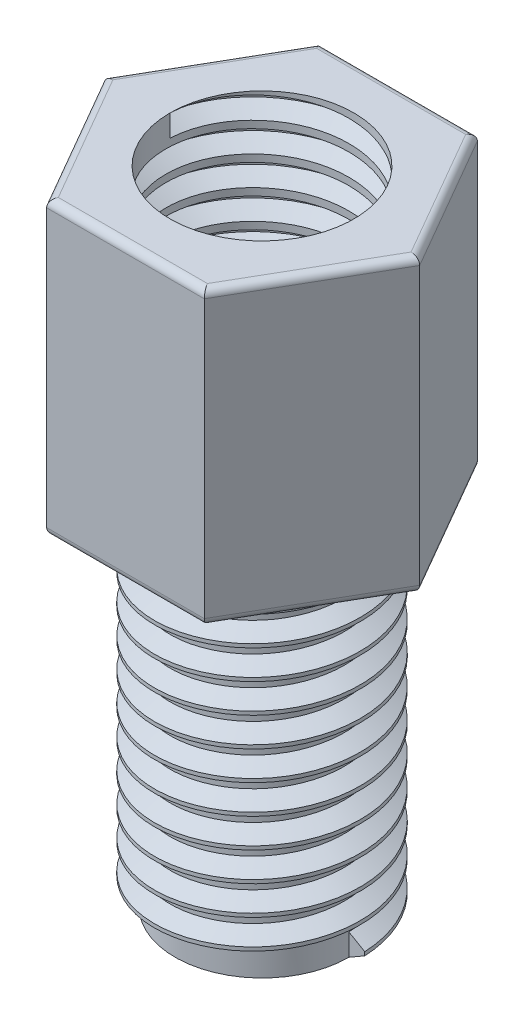
from build123d import *

# Parameters (mm, degrees)
BOSS_EXTRUDE1_DEPTH              = 5
BOSS_EXTRUDE2_START              = -5
SKETCH2_R                        = 1.49
BOSS_EXTRUDE2_DEPTH              = 6
TAP_DRILL_FOR_M3_HELICOIL1_D     = 3.15
TAP_DRILL_FOR_M3_HELICOIL1_DEPTH = 3
TAP_DRILL_FOR_M3_HELICOIL1_TIP   = 0.946355475
THREAD1_PITCH                    = 0.5
THREAD2_PITCH                    = 0.5
FILLET1_R                        = 0.127


with BuildPart() as part:
    # Sketch1 → Boss-Extrude1 (new body)
    with BuildSketch(Plane(origin=(0, 0, 0), x_dir=(1, 0, 0), z_dir=(0, 1, 0))):
        Polygon((2.70199926, 0), (1.35099963, 2.34), (-1.35099963, 2.34), (-2.70199926, 0), (-1.35099963, -2.34), (1.35099963, -2.34), align=None)
    extrude(amount=BOSS_EXTRUDE1_DEPTH)

    # Sketch2 → Boss-Extrude2 (add)
    with BuildSketch(Plane(origin=(0, 5, 0), x_dir=(1, 0, 0), z_dir=(0, 1, 0)).offset(BOSS_EXTRUDE2_START)):
        with Locations(Location((0, 0, 0), (0, 0, 270))):
            Circle(SKETCH2_R)
    extrude(amount=-BOSS_EXTRUDE2_DEPTH)

    # Tap Drill for M3 Helicoil1
    with Locations(Plane(origin=(0, 5, 0), x_dir=(1, 0, 0), z_dir=(0, 1, 0))):
        with Locations((0, 0)):
            Hole(TAP_DRILL_FOR_M3_HELICOIL1_D / 2, depth=TAP_DRILL_FOR_M3_HELICOIL1_DEPTH)
            with Locations((0, 0, -(TAP_DRILL_FOR_M3_HELICOIL1_DEPTH + TAP_DRILL_FOR_M3_HELICOIL1_TIP / 2))):  # 118° drill point
                Cone(0, TAP_DRILL_FOR_M3_HELICOIL1_D / 2, TAP_DRILL_FOR_M3_HELICOIL1_TIP, mode=Mode.SUBTRACT)

    # Thread1: the profile of Thread Profile1 profile screwed along a right-hand helix of 12 turns, 6 arcs to a turn; built about Z, then put on its axis
    thread1_z = Axis((0, 0, 0), (0, 0, 1))
    thread1_corners = [(1.4897, 0, -0.000173205), (1.760632938, 0, 0.156249999), (1.760632938, 0, 0.218749999), (1.4897, 0, 0.375173204)]
    with BuildLine(mode=Mode.PRIVATE) as thread1_profile:
        Line(thread1_corners[0], thread1_corners[1])
        Line(thread1_corners[1], thread1_corners[2])
        Line(thread1_corners[2], thread1_corners[3])
        Line(thread1_corners[3], thread1_corners[0])
    thread1_cap = Face(thread1_profile.wire())
    thread1_turn_angles = [0, 30, 60, 90, 120, 150, 180, 210, 240, 270, 300, 330, 360]
    thread1_turn_weights = [1, 0.8660254037844387, 1, 0.8660254037844387, 1, 0.8660254037844387, 1, 0.8660254037844387, 1, 0.8660254037844387, 1, 0.8660254037844387, 1]
    thread1_turn_rails = [Edge.make_bspline([Vector(p[0], p[1], 0).rotate(thread1_z, thread1_turn_angles[k]) / thread1_turn_weights[k] + Vector(0, 0, p[2] + THREAD1_PITCH * thread1_turn_angles[k] / 360) for k in range(13)], [0, 0, 0, 1, 1, 2, 2, 3, 3, 4, 4, 5, 5, 6, 6, 6], 2, thread1_turn_weights) for p in thread1_corners]
    thread1_turn_sides = [Face.make_surface_from_curves(thread1_turn_rails[p[0]], thread1_turn_rails[p[1]]) for p in [(0, 1), (1, 2), (2, 3), (3, 0)]]
    thread1 = Plane(origin=(0, -6, 0), x_dir=(1, 0, 0), z_dir=(0, 1, 0)) * Solid(Shell([*[p.moved(Location((0, 0, THREAD1_PITCH * i))) for i in range(12) for p in thread1_turn_sides], thread1_cap, thread1_cap.rotate(thread1_z, 4320).moved(Location((0, 0, THREAD1_PITCH * 4320 / 360)))]))
    add(thread1)

    # Thread2: the profile of Thread Profile2 profile screwed along a right-hand helix of 6 turns, 6 arcs to a turn; built about Z, then put on its axis
    thread2_z = Axis((0, 0, 0), (0, 0, 1))
    thread2_corners = [(1.5747, 0, -0.000173205), (1.845632937, 0, 0.156249999), (1.845632937, 0, 0.218749999), (1.5747, 0, 0.375173204)]
    with BuildLine(mode=Mode.PRIVATE) as thread2_profile:
        Line(thread2_corners[0], thread2_corners[1])
        Line(thread2_corners[1], thread2_corners[2])
        Line(thread2_corners[2], thread2_corners[3])
        Line(thread2_corners[3], thread2_corners[0])
    thread2_cap = Face(thread2_profile.wire())
    thread2_turn_angles = [0, 30, 60, 90, 120, 150, 180, 210, 240, 270, 300, 330, 360]
    thread2_turn_weights = [1, 0.8660254037844387, 1, 0.8660254037844387, 1, 0.8660254037844387, 1, 0.8660254037844387, 1, 0.8660254037844387, 1, 0.8660254037844387, 1]
    thread2_turn_rails = [Edge.make_bspline([Vector(p[0], p[1], 0).rotate(thread2_z, thread2_turn_angles[k]) / thread2_turn_weights[k] + Vector(0, 0, p[2] + THREAD2_PITCH * thread2_turn_angles[k] / 360) for k in range(13)], [0, 0, 0, 1, 1, 2, 2, 3, 3, 4, 4, 5, 5, 6, 6, 6], 2, thread2_turn_weights) for p in thread2_corners]
    thread2_turn_sides = [Face.make_surface_from_curves(thread2_turn_rails[p[0]], thread2_turn_rails[p[1]]) for p in [(0, 1), (1, 2), (2, 3), (3, 0)]]
    thread2 = Plane(origin=(0, 5, 0), x_dir=(-1, 0, 0), z_dir=(0, -1, 0)) * Solid(Shell([*[p.moved(Location((0, 0, THREAD2_PITCH * i))) for i in range(6) for p in thread2_turn_sides], thread2_cap, thread2_cap.rotate(thread2_z, 2160).moved(Location((0, 0, THREAD2_PITCH * 2160 / 360)))]))
    add(thread2, mode=Mode.SUBTRACT)

    # Fillet1
    fillet1_edges = [part.edges().sort_by_distance(p)[0] for p in [
        (0, 5, -2.34),
        (-2.026499445, 5, -1.17),
        (-2.026499445, 5, 1.17),
        (0, 5, 2.34),
        (2.026499445, 5, 1.17),
        (0, 0, 2.34),
        (-2.026499445, 0, 1.17),
        (-2.026499445, 0, -1.17),
        (2.026499445, 5, -1.17),
        (0, 0, -2.34),
        (2.026499445, 0, -1.17),
        (2.026499445, 0, 1.17),
    ]]
    fillet(fillet1_edges, radius=FILLET1_R)


solid = part.part
